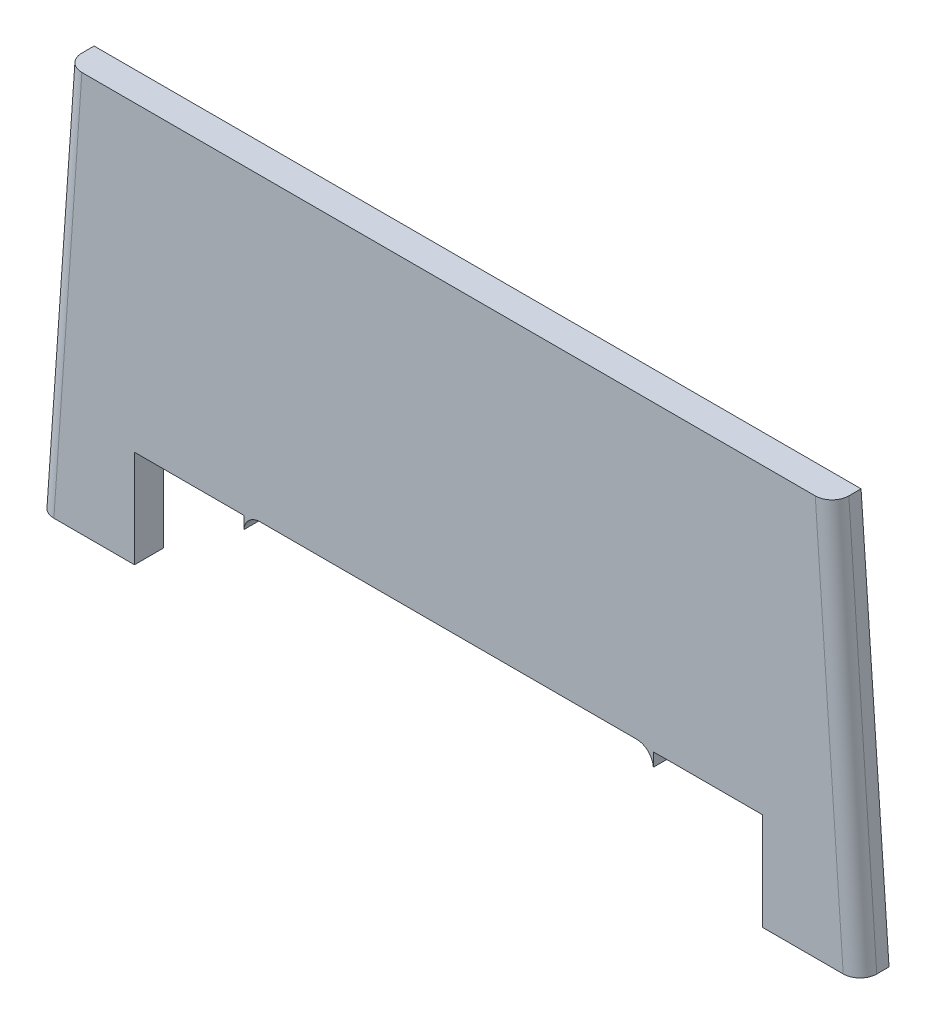
from build123d import *

# Parameters (mm, degrees)
BOSS_EXTRUDE1_DEPTH = 23.2
FILLET1_R           = 13.4
SHELL1_START        = 554.066138639
SHELL1_DEPTH        = 22.2
SHELL1_START_2      = -740.047251584
SHELL1_2_DEPTH      = 319.643616058
SHELL1_START_3      = 428.823224764
SHELL1_3_DEPTH      = 319.643616058
BOSS_EXTRUDE2_START = -0.6
BOSS_EXTRUDE2_DEPTH = 0.6


with BuildPart() as part:
    # Sketch1 → Boss-Extrude1 (new body)
    with BuildSketch(Plane(origin=(0, 0, 577.266138639), x_dir=(-1, 0, 0), z_dir=(0, 0, -1))):
        with BuildLine():
            Line((246.373543052, 767.588219351), (232.840577428, 767.588219351))
            Line((232.840577428, 767.588219351), (221.373543052, 767.588219351))
            Line((221.373543052, 767.588219351), (-342.073297304, 767.588219351))
            Line((-342.073297304, 767.588219351), (-353.54033168, 767.588219351))
            Line((-353.54033168, 767.588219351), (-367.073297304, 767.588219351))
            Line((-367.073297304, 767.588219351), (-389.449877126, 447.588219351))
            Line((-389.449877126, 447.588219351), (-375.949877126, 447.588219351))
            Line((-375.949877126, 447.588219351), (-364.449877126, 447.588219351))
            Line((-364.449877126, 447.588219351), (-311.549877126, 447.588219351))
            Line((-311.549877126, 447.588219351), (-311.549877126, 525.588219351))
            Line((-311.549877126, 525.588219351), (-311.490727804, 525.588219351))
            Line((-311.490727804, 525.588219351), (-239.490727804, 525.588219351))
            Line((-239.490727804, 525.588219351), (-224.106525446, 525.500426272))
            Line((-224.106525446, 525.500426272), (-224.106525446, 514.79475476))
            ThreePointArc((-224.106525446, 514.79475476), (-219.917813499, 523.880773359), (-210.625026727, 527.588219351))
            Line((-210.625026727, 527.588219351), (90.450122874, 527.588219351))
            ThreePointArc((90.450122874, 527.588219351), (99.259487157, 524.148297851), (103.406771195, 515.649004109))
            Line((103.406771195, 515.649004109), (103.406771195, 525.500426272))
            Line((103.406771195, 525.500426272), (103.450122874, 525.588219351))
            Line((103.450122874, 525.588219351), (190.850122874, 525.588219351))
            Line((190.850122874, 525.588219351), (190.850122874, 447.588219351))
            Line((190.850122874, 447.588219351), (243.750122874, 447.588219351))
            Line((243.750122874, 447.588219351), (255.21715725, 447.588219351))
            Line((255.21715725, 447.588219351), (255.250122874, 447.588219351))
            Line((255.250122874, 447.588219351), (268.750122874, 447.588219351))
            Line((268.750122874, 447.588219351), (246.373543052, 767.588219351))
        make_face()
    extrude(amount=BOSS_EXTRUDE1_DEPTH)

    # Fillet1
    fillet1_edges = [part.edges().sort_by_distance(p)[0] for p in [
        (378.261587215, 607.588219351, 577.266138639),
        (-257.561832963, 607.588219351, 577.266138639),
    ]]
    fillet(fillet1_edges, radius=FILLET1_R)

    # Shell1: read off the stored shape, not the designer's step
    # Shell1 outline → Shell1 (cut)
    with BuildSketch(Plane.XY.offset(SHELL1_START)):
        with BuildLine():
            Line((-245.441027966, 766.588219351), (-267.677754164, 448.588219351))
            Line((-267.677754164, 448.588219351), (-191.850122874, 448.588219351))
            Line((-191.850122874, 448.588219351), (-191.850122874, 526.588219351))
            Line((-191.850122874, 526.588219351), (-102.828644378, 526.588219351))
            Line((-102.828644378, 526.588219351), (-102.406771195, 525.73386847))
            Line((-102.406771195, 525.73386847), (-102.406771195, 521.870977135))
            ThreePointArc((-102.406771195, 521.870977135), (-97.307286684, 526.793927216), (-90.450122874, 528.588219351))
            Line((-90.450122874, 528.588219351), (210.625026727, 528.588219351))
            ThreePointArc((210.625026727, 528.588219351), (217.80980826, 526.683016464), (223.106525446, 521.468069601))
            Line((223.106525446, 521.468069601), (223.106525446, 526.494735851))
            Line((223.106525446, 526.494735851), (239.487874476, 526.588219351))
            Line((239.487874476, 526.588219351), (312.549877126, 526.588219351))
            Line((312.549877126, 526.588219351), (312.549877126, 448.588219351))
            Line((312.549877126, 448.588219351), (388.377508416, 448.588219351))
            Line((388.377508416, 448.588219351), (366.140782218, 766.588219351))
            Line((366.140782218, 766.588219351), (-245.441027966, 766.588219351))
        make_face()
    extrude(amount=SHELL1_DEPTH, mode=Mode.SUBTRACT)

    # Shell1 2 outline → Shell1 2 (add)
    with BuildSketch(Plane(origin=(0, 0, 0), x_dir=(0.9975640502598233, 0.06975647374413793, 0), z_dir=(0.06975647374413793, -0.9975640502598234, 0)).offset(SHELL1_START_2)):
        with BuildLine():
            ThreePointArc((406.32337267, 576.266138639), (415.091496757, 572.634262726), (418.72337267, 563.866138639))
            Line((418.72337267, 563.866138639), (418.72337267, 568.945508678))
            ThreePointArc((418.72337267, 568.945508678), (415.798603538, 573.341369507), (411.40274271, 576.266138639))
            Line((411.40274271, 576.266138639), (406.32337267, 576.266138639))
        make_face()
    extrude(amount=SHELL1_2_DEPTH)

    # Shell1 3 outline → Shell1 3 (add)
    with BuildSketch(Plane(origin=(0, 0, 0), x_dir=(0.9975640502598233, -0.06975647374413843, 0), z_dir=(0.06975647374413843, 0.9975640502598233, 0)).offset(SHELL1_START_3)):
        with BuildLine():
            ThreePointArc((-285.917636954, -576.266138639), (-294.68576104, -572.634262725), (-298.317636954, -563.866138639))
            Line((-298.317636954, -563.866138639), (-298.317636953, -568.94550868))
            ThreePointArc((-298.317636953, -568.94550868), (-295.392867822, -573.341369507), (-290.997006994, -576.266138639))
            Line((-290.997006994, -576.266138639), (-285.917636954, -576.266138639))
        make_face()
    extrude(amount=SHELL1_3_DEPTH)

    # Sketch2 → Boss-Extrude2 (add)
    with BuildSketch(Plane(origin=(0, 0, 554.066138639), x_dir=(-1, 0, 0), z_dir=(0, 0, -1)).offset(BOSS_EXTRUDE2_START)):
        with BuildLine():
            Line((246.373543052, 767.588219351), (-367.073297304, 767.588219351))
            Line((-367.073297304, 767.588219351), (-389.449877126, 447.588219351))
            Line((-389.449877126, 447.588219351), (-311.549877126, 447.588219351))
            Line((-311.549877126, 447.588219351), (-311.549877126, 525.588219351))
            Line((-311.549877126, 525.588219351), (-311.312198799, 525.588219351))
            Line((-311.312198799, 525.588219351), (-239.490727804, 525.588219351))
            Line((-239.490727804, 525.588219351), (-224.106525446, 525.500426272))
            Line((-224.106525446, 525.500426272), (-224.106525446, 514.79475476))
            ThreePointArc((-224.106525446, 514.79475476), (-219.917813499, 523.880773359), (-210.625026727, 527.588219351))
            Line((-210.625026727, 527.588219351), (90.450122874, 527.588219351))
            ThreePointArc((90.450122874, 527.588219351), (99.259487157, 524.148297851), (103.406771195, 515.649004109))
            Line((103.406771195, 515.649004109), (103.406771195, 525.500426272))
            Line((103.406771195, 525.500426272), (103.450122874, 525.588219351))
            Line((103.450122874, 525.588219351), (190.612444548, 525.588219351))
            Line((190.612444548, 525.588219351), (190.850122874, 525.588219351))
            Line((190.850122874, 525.588219351), (190.850122874, 525.176548414))
            Line((190.850122874, 525.176548414), (190.850122874, 447.588219351))
            Line((190.850122874, 447.588219351), (268.750122874, 447.588219351))
            Line((268.750122874, 447.588219351), (246.373543052, 767.588219351))
        make_face()
    extrude(amount=BOSS_EXTRUDE2_DEPTH)


solid = part.part
